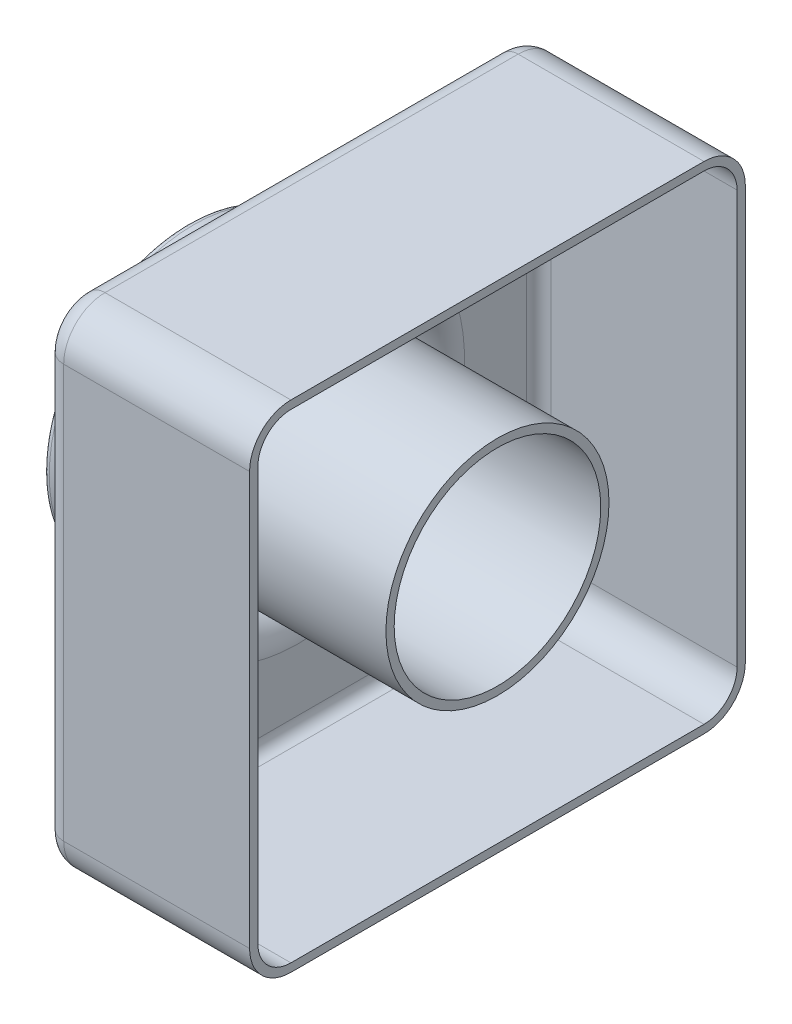
from build123d import *

# Parameters (mm, degrees)
SKIZZE1_W                            = 120
SKIZZE1_H                            = 120
AUFSATZ_LINEAR_AUSTRAGEN1_DEPTH      = 50
SKIZZE4_R                            = 35
AUFSATZ_LINEAR_AUSTRAGEN3_DEPTH      = 25
SCHNITT_LINEAR_AUSTRAGEN1_DEPTH      = 177.91806013
SCHNITT_LINEAR_AUSTRAGEN1_DEPTH_BACK = 177.91806013
SKIZZE5_R                            = 25
VERRUNDUNG1_R                        = 10
VERRUNDUNG9_R                        = 5
WANDUNG1_T                           = -2
VERRUNDUNG3_R                        = 1.5


with BuildPart() as part:
    # Skizze1 → Aufsatz-Linear austragen1 (new body)
    with BuildSketch(Plane.YZ):
        with Locations((60, 60)):
            Rectangle(SKIZZE1_W, SKIZZE1_H)
    extrude(amount=AUFSATZ_LINEAR_AUSTRAGEN1_DEPTH)

    # Skizze4 → Aufsatz-Linear austragen3 (add)
    with BuildSketch(Plane.YZ):
        with Locations((60, 60)):
            Circle(SKIZZE4_R)
    extrude(amount=-AUFSATZ_LINEAR_AUSTRAGEN3_DEPTH)

    # Skizze5 → Schnitt-Linear austragen1 (cut, two sides: drawn at the far end of the back side and taken through both)
    with BuildSketch(Plane.YZ.offset(-SCHNITT_LINEAR_AUSTRAGEN1_DEPTH_BACK)):
        with Locations((60, 60)):
            Circle(SKIZZE5_R)
    extrude(amount=SCHNITT_LINEAR_AUSTRAGEN1_DEPTH + SCHNITT_LINEAR_AUSTRAGEN1_DEPTH_BACK, mode=Mode.SUBTRACT)

    # Verrundung1
    verrundung1_edges = [part.edges().sort_by_distance(p)[0] for p in [
        (25, 0, 120),
        (25, 120, 120),
        (25, 120, 0),
        (25, 0, 0),
    ]]
    fillet(verrundung1_edges, radius=VERRUNDUNG1_R)

    # Verrundung9
    verrundung9_edges = [part.edges().sort_by_distance(p)[0] for p in [
        (0, 2.928932188, 117.071067812),
        (0, 0, 60),
        (0, 2.928932188, 2.928932188),
        (0, 60, 0),
        (0, 117.071067812, 2.928932188),
        (0, 120, 60),
        (0, 117.071067812, 117.071067812),
        (0, 60, 120),
        (0, 25, 60),
    ]]
    fillet(verrundung9_edges, radius=VERRUNDUNG9_R)

    # Wandung1
    wandung1_openings = [part.faces().sort_by_distance(p)[0] for p in [
        (50, 60, 1.697056275),
    ]]
    offset(amount=WANDUNG1_T, openings=wandung1_openings, kind=Kind.INTERSECTION)

    # Verrundung3
    verrundung3_edges = [part.edges().sort_by_distance(p)[0] for p in [
        (-25, 25, 60),
        (-25, 35, 60),
    ]]
    fillet(verrundung3_edges, radius=VERRUNDUNG3_R)


solid = part.part
